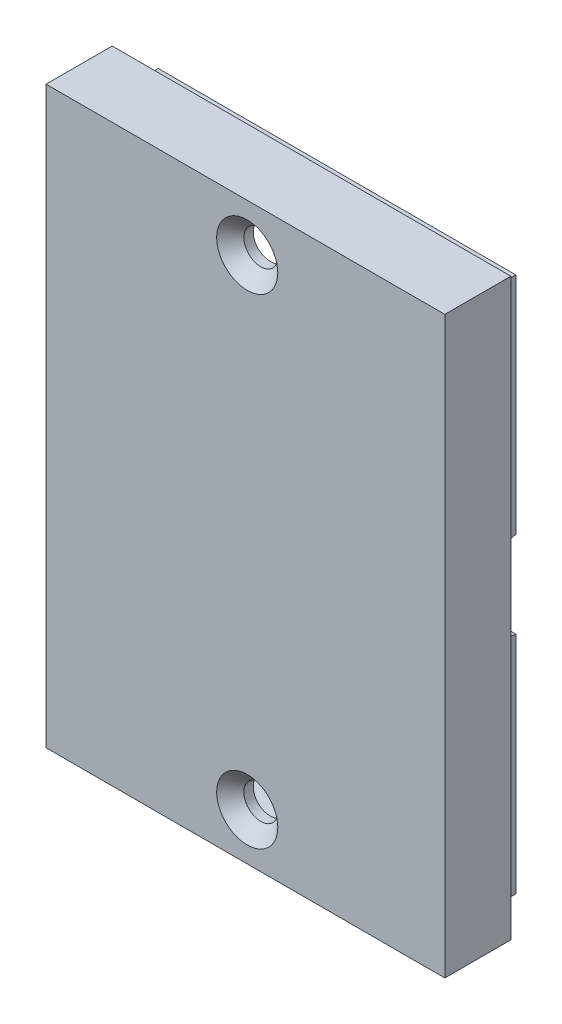
from build123d import *

# Parameters (mm, degrees)
SKETCH2_W                                       = 31.623
SKETCH2_H                                       = 47.371
SKETCH2_W_2                                     = 30.48
SKETCH2_H_2                                     = 46.355
BOSS_EXTRUDE1_DEPTH                             = 2.032
SKETCH3_W                                       = 35.2425
SKETCH3_H                                       = 50.8
SKETCH3_W_2                                     = 30.48
SKETCH3_H_2                                     = 46.355
BOSS_EXTRUDE2_DEPTH                             = 3.81
SKETCH4_W                                       = 35.2425
SKETCH4_H                                       = 50.8
BOSS_EXTRUDE3_DEPTH                             = 2.032
CUT_EXTRUDE1_REACH                              = 62.138
CUT_EXTRUDE2_REACH                              = 61.89
SKETCH6_W                                       = 1.778
SKETCH6_H                                       = 2.54
FILLET1_R                                       = 1.27
CSK_FOR_M3_FLAT_HEAD_MACHINE_SCREW1_D           = 3
CSK_FOR_M3_FLAT_HEAD_MACHINE_SCREW1_CSINK_D     = 5.4
CSK_FOR_M3_FLAT_HEAD_MACHINE_SCREW1_CSINK_ANGLE = 90


with BuildPart() as part:
    # Sketch2 → Boss-Extrude1 (new body)
    with BuildSketch(Plane.XY):
        with Locations((15.9385, 23.8125)):
            Rectangle(SKETCH2_W, SKETCH2_H)
        with Locations((15.875, 23.8125)):
            Rectangle(SKETCH2_W_2, SKETCH2_H_2, mode=Mode.SUBTRACT)
    extrude(amount=BOSS_EXTRUDE1_DEPTH)

    # Sketch3 → Boss-Extrude2 (add)
    with BuildSketch(Plane.XY.offset(2.032)):
        with Locations((15.71625, 23.8125)):
            Rectangle(SKETCH3_W, SKETCH3_H)
        with Locations((15.875, 23.8125)):
            Rectangle(SKETCH3_W_2, SKETCH3_H_2, mode=Mode.SUBTRACT)
    extrude(amount=BOSS_EXTRUDE2_DEPTH)

    # Sketch4 → Boss-Extrude3 (add)
    with BuildSketch(Plane.XY.offset(5.842)):
        with Locations((15.71625, 23.8125)):
            Rectangle(SKETCH4_W, SKETCH4_H)
    extrude(amount=BOSS_EXTRUDE3_DEPTH)

    # Sketch5 → Cut-Extrude1 (cut, up to next)
    with BuildSketch(Plane(origin=(31.75, 0, 0), x_dir=(0, 0, -1), z_dir=(1, 0, 0)), mode=Mode.PRIVATE) as cut_extrude1_sk1:
        with BuildLine():
            Line((1.27, 26.3525), (1.27, 21.2725))
            ThreePointArc((1.27, 21.2725), (0, 20.0025), (-1.27, 21.2725))
            Line((-1.27, 21.2725), (-1.27, 26.3525))
            ThreePointArc((-1.27, 26.3525), (0, 27.6225), (1.27, 26.3525))
        make_face()
    cut_extrude1_tool1 = extrude(cut_extrude1_sk1.sketch, amount=-CUT_EXTRUDE1_REACH, mode=Mode.PRIVATE) & part.part
    add(cut_extrude1_tool1.solids().sort_by_distance((31.75, 23.8125, 0))[0], mode=Mode.SUBTRACT)

    # Sketch6 → Cut-Extrude2 (cut, up to next)
    with BuildSketch(Plane.ZY.offset(-0.127), mode=Mode.PRIVATE) as cut_extrude2_sk1:
        with Locations((0.889, 45.72)):
            Rectangle(SKETCH6_W, SKETCH6_H)
    cut_extrude2_tool1 = extrude(cut_extrude2_sk1.sketch, amount=-CUT_EXTRUDE2_REACH, mode=Mode.PRIVATE) & part.part
    # Sketch6 → Cut-Extrude2 (cut, up to next)
    with BuildSketch(Plane.ZY.offset(-0.127), mode=Mode.PRIVATE) as cut_extrude2_sk2:
        with Locations((0.889, 1.905)):
            Rectangle(SKETCH6_W, SKETCH6_H)
    cut_extrude2_tool2 = extrude(cut_extrude2_sk2.sketch, amount=-CUT_EXTRUDE2_REACH, mode=Mode.PRIVATE) & part.part
    # Sketch6 → Cut-Extrude2 (cut, up to next)
    with BuildSketch(Plane.ZY.offset(-0.127), mode=Mode.PRIVATE) as cut_extrude2_sk3:
        with Locations((0.889, 23.8125)):
            Rectangle(SKETCH6_W, SKETCH6_H)
    cut_extrude2_tool3 = extrude(cut_extrude2_sk3.sketch, amount=-CUT_EXTRUDE2_REACH, mode=Mode.PRIVATE) & part.part
    add(cut_extrude2_tool1.solids().sort_by_distance((0.127, 45.72, 0.889))[0], mode=Mode.SUBTRACT)
    add(cut_extrude2_tool2.solids().sort_by_distance((0.127, 1.905, 0.889))[0], mode=Mode.SUBTRACT)
    add(cut_extrude2_tool3.solids().sort_by_distance((0.127, 23.8125, 0.889))[0], mode=Mode.SUBTRACT)

    # Fillet1
    fillet1_edges = [part.edges().sort_by_distance(p)[0] for p in [
        (0.381, 3.175, 1.778),
        (0.381, 0.635, 1.778),
        (0.381, 22.5425, 1.778),
        (0.381, 25.0825, 1.778),
        (0.381, 46.99, 1.778),
        (0.381, 44.45, 1.778),
    ]]
    fillet(fillet1_edges, radius=FILLET1_R - 0.0001)  # a hair under: the kernel refuses the full size

    # CSK for M3 Flat Head Machine Screw1 (through all)
    with Locations(Plane.XY.offset(7.874)):
        with Locations((15.875, 2.564617431), (15.875, 45.016869066)):
            CounterSinkHole(CSK_FOR_M3_FLAT_HEAD_MACHINE_SCREW1_D / 2, CSK_FOR_M3_FLAT_HEAD_MACHINE_SCREW1_CSINK_D / 2, counter_sink_angle=CSK_FOR_M3_FLAT_HEAD_MACHINE_SCREW1_CSINK_ANGLE)


solid = part.part
